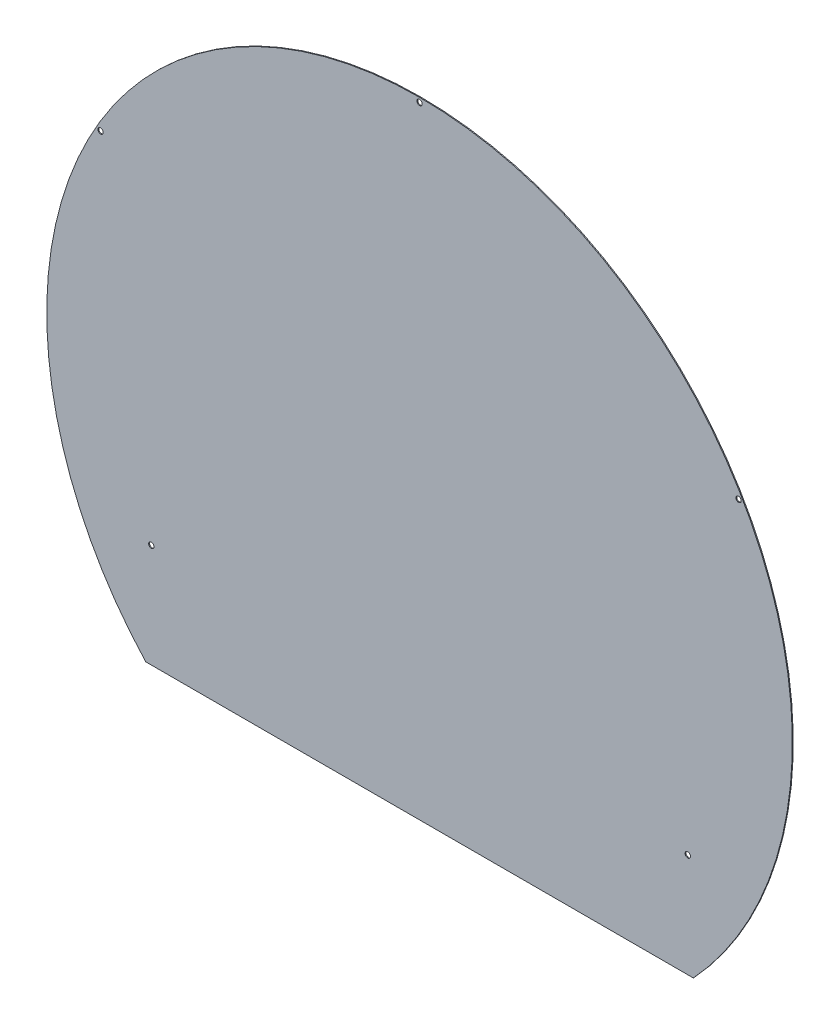
from build123d import *

# Parameters (mm, degrees)
SM_BASE_FLANGE_1_DEPTH = 1
SKETCH_2_R             = 3
CUT_EXTRUDE_1_DEPTH    = 815.794452608


# Sheet-metal steps are written as plain solids
with BuildPart() as part:
    # Sketch 1 → Базовая кромка1 (new body)
    with BuildSketch(Plane.XY):
        with BuildLine():
            Line((-306.267856622, 0), (306.267856622, 0))
            ThreePointArc((306.267856622, 0), (0, 700), (-306.267856622, 0))
        make_face()
    extrude(amount=-SM_BASE_FLANGE_1_DEPTH)

    # Эскиз2 → Вырез-Вытянуть1 (cut, through all)
    with BuildSketch(Plane.XY):
        with Locations((-300, 116.083573562)):
            Circle(SKETCH_2_R)
        with Locations((300, 116.083573562)):
            Circle(SKETCH_2_R)
        with Locations((0, 695)):
            Circle(SKETCH_2_R)
        with Locations((356.802466359, 489)):
            Circle(SKETCH_2_R)
        with Locations((-356.802466359, 489)):
            Circle(SKETCH_2_R)
    extrude(amount=-CUT_EXTRUDE_1_DEPTH, mode=Mode.SUBTRACT)


solid = part.part
